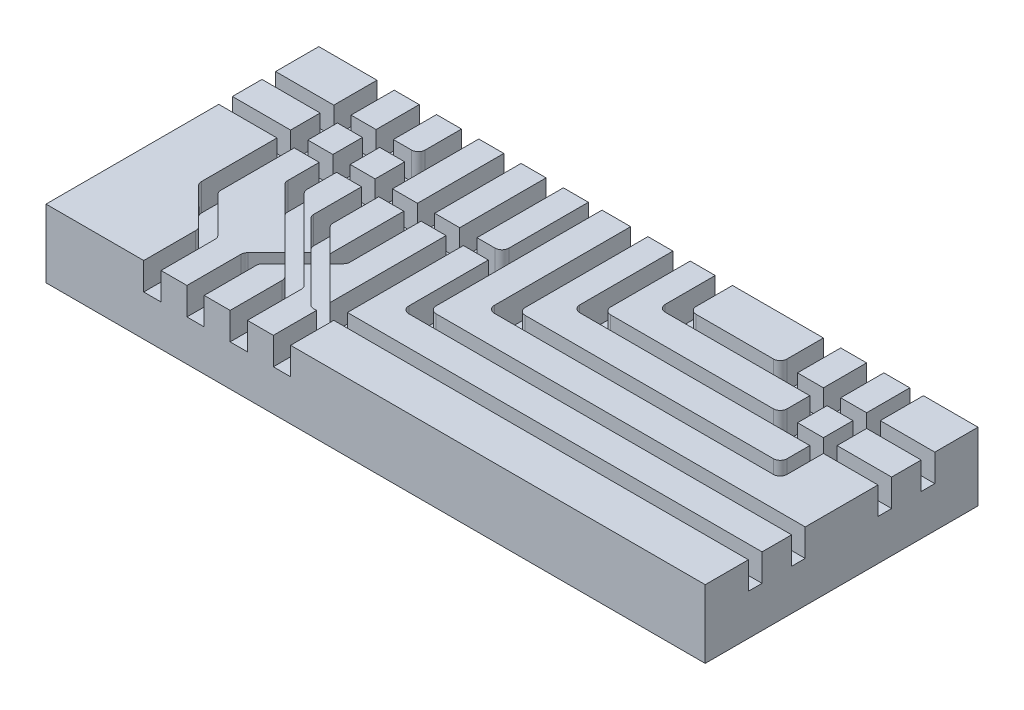
from build123d import *

# Parameters (mm, degrees)
SKETCH1_W                        = 145
SKETCH1_H                        = 60
PROFILEBOSS_EXTRUDE1_DEPTH       = 15
SKETCH2_W                        = 5.5
SKETCH2_H                        = 6.5
SKETCH2_W_2                      = 5.7
LEEDCUT_EXTRUDE1_DEPTH           = 6
FILLET1_R                        = 1.5
FILLET2_R                        = 1.5
FILLET3_R                        = 1.5
MOUNTHOLECUT_EXTRUDE2_DEPTH      = 3.1
MOUNTHOLECUT_EXTRUDE2_DEPTH_BACK = 0.1
MOUNTHOLESKETCH3_R               = 2.05


with BuildPart() as part:
    # Sketch1 → ProfileBoss-Extrude1 (new body)
    with BuildSketch(Plane(origin=(0, 0, 0), x_dir=(1, 0, 0), z_dir=(0, 1, 0))):
        with Locations((72.5, 30)):
            Rectangle(SKETCH1_W, SKETCH1_H)
    extrude(amount=PROFILEBOSS_EXTRUDE1_DEPTH)

    # Sketch2 → LeedCut-Extrude1 (cut)
    # profile 1 of 2: a face of its own
    with BuildSketch(Plane(origin=(0, 15, 0), x_dir=(1, 0, 0), z_dir=(0, 1, 0))):
        Polygon((25.9, 60), (22.1, 60), (22.1, 50.5), (16.6, 50.5), (16.6, 60), (12.8, 60), (12.8, 50.5), (0, 50.5), (0, 47.5), (12.8, 47.5), (12.8, 41), (0, 41), (0, 38), (12.8, 38), (12.8, 20.757359313), (21.5, 12.057359313), (21.5, 0), (25.3, 0), (25.3, 12.5), (16.6, 21.2), (16.6, 38), (22.1, 38), (22.1, 30.457359313), (35.528679656, 17.028679656), (31, 12.5), (31, 0), (34.8, 0), (34.8, 12.057359313), (37.65, 14.907359313), (40.5, 12.057359313), (40.5, 0), (44.3, 0), (44.3, 12.5), (39.771320344, 17.028679656), (40.5, 17.757359313), (48.757359313, 9.5), (50, 9.5), (50, 0), (53.8, 0), (53.8, 9.5), (145, 9.5), (145, 12.5), (53.8, 12.5), (53.8, 38), (59.3, 38), (59.3, 19), (145, 19), (145, 22), (62.3, 22), (62.3, 60), (59.3, 60), (59.3, 41), (53.8, 41), (53.8, 60), (50, 60), (50, 41), (44.5, 41), (44.5, 60), (40.7, 60), (40.7, 41), (35.2, 41), (35.2, 60), (31.4, 60), (31.4, 50.5), (25.9, 50.5), align=None)
        Polygon((50, 12.5), (50, 38), (44.5, 38), (44.5, 21.757359313), (42.621320344, 19.878679656), align=None, mode=Mode.SUBTRACT)
        Polygon((31.4, 26.857359313), (31.4, 38), (25.9, 38), (25.9, 30.9), (37.65, 19.15), (38.378679656, 19.878679656), align=None, mode=Mode.SUBTRACT)
        Polygon((40.7, 21.8), (35.2, 27.3), (35.2, 38), (40.7, 38), align=None, mode=Mode.SUBTRACT)
        with Locations((19.35, 44.25)):
            Rectangle(SKETCH2_W, SKETCH2_H, mode=Mode.SUBTRACT)
        with Locations((28.65, 44.25)):
            Rectangle(SKETCH2_W, SKETCH2_H, mode=Mode.SUBTRACT)
    # profile 2 of 2: a face of its own
    with BuildSketch(Plane(origin=(0, 15, 0), x_dir=(1, 0, 0), z_dir=(0, 1, 0))):
        Polygon((72.4, 60), (72.4, 31.5), (130, 31.5), (130, 38), (77.9, 38), (77.9, 60), (81.7, 60), (81.7, 41), (120.5, 41), (120.5, 47.5), (87.2, 47.5), (87.2, 60), (91, 60), (91, 50.5), (111, 50.5), (111, 60), (114.8, 60), (114.8, 50.5), (120.5, 50.5), (120.5, 60), (124.3, 60), (124.3, 50.5), (130, 50.5), (130, 60), (133, 60), (133, 50.5), (145, 50.5), (145, 47.5), (133, 47.5), (133, 41), (145, 41), (145, 38), (133, 38), (133, 28.5), (68.6, 28.5), (68.6, 60), align=None)
        with Locations((127.15, 44.25)):
            Rectangle(SKETCH2_W_2, SKETCH2_H, mode=Mode.SUBTRACT)
    extrude(amount=-LEEDCUT_EXTRUDE1_DEPTH, mode=Mode.SUBTRACT)

    # Fillet1
    fillet1_edges = [part.edges().sort_by_distance(p)[0] for p in [
        (87.2, 12, -47.5),
        (59.3, 12, -19),
        (68.6, 12, -28.5),
        (77.9, 12, -38),
        (62.3, 12, -22),
        (72.4, 12, -31.5),
        (81.7, 12, -41),
        (91, 12, -50.5),
    ]]
    fillet(fillet1_edges, radius=FILLET1_R)

    # Fillet2
    fillet2_edges = [part.edges().sort_by_distance(p)[0] for p in [
        (130, 12, -31.5),
        (120.5, 12, -41),
        (111, 12, -50.5),
        (133, 12, -28.5),
        (59.3, 12, -41),
        (31.4, 12, -50.5),
    ]]
    fillet(fillet2_edges, radius=FILLET2_R)

    # Fillet3
    fillet3_edges = [part.edges().sort_by_distance(p)[0] for p in [
        (25.3, 12, -12.5),
        (34.8, 12, -12.057359313),
        (31.4, 12, -26.857359313),
        (12.8, 12, -20.757359313),
        (21.5, 12, -12.057359313),
        (31, 12, -12.5),
        (44.3, 12, -12.5),
        (40.5, 12, -12.057359313),
        (48.757359313, 12, -9.5),
        (16.6, 12, -21.2),
        (35.2, 12, -27.3),
        (25.9, 12, -30.9),
        (22.1, 12, -30.457359313),
        (44.5, 12, -21.757359313),
    ]]
    fillet(fillet3_edges, radius=FILLET3_R)

    # MountHoleSketch3 → MountHoleCut-Extrude2 (cut, two sides: drawn at the far end of the back side and taken through both)
    with BuildSketch(Plane(origin=(0, 0, 0), x_dir=(1, 0, 0), z_dir=(0, 1, 0)).offset(-MOUNTHOLECUT_EXTRUDE2_DEPTH_BACK)):
        with Locations((6, 30)):
            Circle(MOUNTHOLESKETCH3_R)
        with Locations((139, 30)):
            Circle(MOUNTHOLESKETCH3_R)
    extrude(amount=MOUNTHOLECUT_EXTRUDE2_DEPTH + MOUNTHOLECUT_EXTRUDE2_DEPTH_BACK, mode=Mode.SUBTRACT)


solid = part.part
